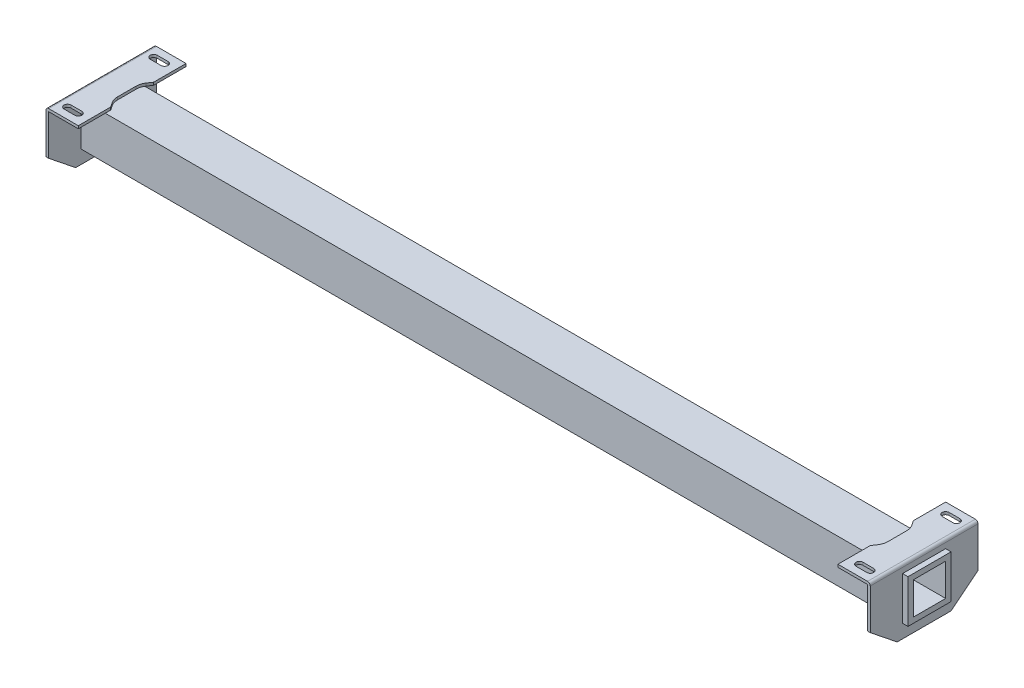
from build123d import *

# Parameters (mm, degrees)
SKETCH3_W                       = 80
SKETCH3_H                       = 80
SKETCH3_W_2                     = 60
SKETCH3_H_2                     = 60
BOSS_EXTRUDE2_DEPTH             = 1550
SKETCH7_W                       = 60
SKETCH7_H                       = 60
BOSS_EXTRUDE3_DEPTH             = 5
BOSS_EXTRUDE4_REACH             = 1561.207
SKETCH8_W                       = 60
SKETCH8_H                       = 5
BOSS_EXTRUDE4_DIRECTION_2_REACH = 1561.207
CUT_EXTRUDE1_REACH              = 1562.929
CUT_EXTRUDE2_REACH              = 1562.929
FILLET1_R                       = 5
MIRROR1_START                   = -90
MIRROR1_DEPTH                   = 10
MIRROR1_2_DEPTH                 = 10
MIRROR1_START_2                 = -80
MIRROR1_3_OUTLINE_W             = 5
MIRROR1_3_OUTLINE_H             = 25
MIRROR1_3_DEPTH                 = 80
MIRROR1_START_3                 = 10
MIRROR1_4_DEPTH                 = 31.124
MIRROR1_START_4                 = -119.452
MIRROR1_5_DEPTH                 = 29.452
MIRROR1_START_5                 = -140
MIRROR1_6_DEPTH                 = 200
MIRROR1_7_DEPTH                 = 5
FILLET1_OF_MIRROR2_R            = 5


with BuildPart() as part:
    # Sketch3 → Boss-Extrude2 (new body)
    with BuildSketch(Plane(origin=(0, 0, 0), x_dir=(0, 0, -1), z_dir=(1, 0, 0))):
        with Locations((40, 40)):
            Rectangle(SKETCH3_W, SKETCH3_H)
        with Locations((40, 40)):
            Rectangle(SKETCH3_W_2, SKETCH3_H_2, mode=Mode.SUBTRACT)
    extrude(amount=BOSS_EXTRUDE2_DEPTH)

    # Sketch7 → Boss-Extrude3 (add)
    with BuildSketch(Plane(origin=(1535, 0, 0), x_dir=(0, 0, -1), z_dir=(1, 0, 0))):
        Polygon((-60, 95), (140, 95), (140, 15), (90, -25), (-10, -25), (-60, 15), align=None)
        with Locations((40, 40)):
            Rectangle(SKETCH7_W, SKETCH7_H, mode=Mode.SUBTRACT)
    boss_extrude3 = extrude(amount=BOSS_EXTRUDE3_DEPTH)

    # Boss-Extrude4: up to this face of the body (flat: up to its plane)
    boss_extrude4_end = Plane(part.part.faces().sort_by_distance((1537.5, 55, -140))[0])
    # Sketch8 → Boss-Extrude4 (add, up to the picked face)
    with BuildSketch(Plane(origin=(0, 0, -80), x_dir=(-1, 0, 0), z_dir=(0, 0, -1)), mode=Mode.PRIVATE) as boss_extrude4_sk1:
        with Locations((-1510, 92.5)):
            Rectangle(SKETCH8_W, SKETCH8_H)
    boss_extrude4_tool1 = split(extrude(boss_extrude4_sk1.sketch, amount=BOSS_EXTRUDE4_REACH, mode=Mode.PRIVATE), bisect_by=boss_extrude4_end, keep=Keep.BOTH, mode=Mode.PRIVATE)
    boss_extrude4 = boss_extrude4_tool1.solids().sort_by(Axis((1510, 92.5, -80), (0, 0, -1)))[0]
    add(boss_extrude4)

    # Boss-Extrude4 direction 2: up to this face of the body (flat: up to its plane)
    boss_extrude4_direction_2_end = Plane(part.part.faces().sort_by_distance((1537.5, 55, 60))[0])
    # Sketch8 → Boss-Extrude4 direction 2 (add, up to the picked face)
    with BuildSketch(Plane(origin=(0, 0, -80), x_dir=(-1, 0, 0), z_dir=(0, 0, -1)), mode=Mode.PRIVATE) as boss_extrude4_direction_2_sk1:
        with Locations((-1510, 92.5)):
            Rectangle(SKETCH8_W, SKETCH8_H)
    boss_extrude4_direction_2_tool1 = split(extrude(boss_extrude4_direction_2_sk1.sketch, amount=-BOSS_EXTRUDE4_DIRECTION_2_REACH, mode=Mode.PRIVATE), bisect_by=boss_extrude4_direction_2_end, keep=Keep.BOTH, mode=Mode.PRIVATE)
    boss_extrude4_direction_2 = boss_extrude4_direction_2_tool1.solids().sort_by(Axis((1510, 92.5, -80), (0, 0, 1)))[0]
    add(boss_extrude4_direction_2)

    # Sketch9 → Cut-Extrude1 (cut, up to next)
    with BuildSketch(Plane(origin=(0, 95, 0), x_dir=(1, 0, 0), z_dir=(0, 1, 0)), mode=Mode.PRIVATE) as cut_extrude1_sk1:
        with BuildLine():
            Line((1480, 80), (1485.801257358, 71.298113962))
            ThreePointArc((1485.801257358, 71.298113962), (1488.927300662, 64.675212774), (1490, 57.430609057))
            Line((1490, 57.430609057), (1490, 22.569390943))
            ThreePointArc((1490, 22.569390943), (1488.927300662, 15.324787226), (1485.801257358, 8.701886038))
            Line((1485.801257358, 8.701886038), (1480, 0))
            Line((1480, 0), (1480, 80))
        make_face()
    cut_extrude1_tool1 = extrude(cut_extrude1_sk1.sketch, amount=-CUT_EXTRUDE1_REACH, mode=Mode.PRIVATE) & part.part
    cut_extrude1 = cut_extrude1_tool1.solids().sort_by_distance((1484.537596, 95, -40))[0]
    add(cut_extrude1, mode=Mode.SUBTRACT)

    # Sketch10 → Cut-Extrude2 (cut, up to next)
    with BuildSketch(Plane(origin=(0, 95, 0), x_dir=(1, 0, 0), z_dir=(0, 1, 0)), mode=Mode.PRIVATE) as cut_extrude2_sk1:
        with BuildLine():
            Line((1500, 126.5), (1520, 126.5))
            ThreePointArc((1520, 126.5), (1526.5, 120), (1520, 113.5))
            Line((1520, 113.5), (1500, 113.5))
            ThreePointArc((1500, 113.5), (1493.5, 120), (1500, 126.5))
        make_face()
    cut_extrude2_tool1 = extrude(cut_extrude2_sk1.sketch, amount=-CUT_EXTRUDE2_REACH, mode=Mode.PRIVATE) & part.part
    # Sketch10 → Cut-Extrude2 (cut, up to next)
    with BuildSketch(Plane(origin=(0, 95, 0), x_dir=(1, 0, 0), z_dir=(0, 1, 0)), mode=Mode.PRIVATE) as cut_extrude2_sk2:
        with BuildLine():
            Line((1500, -33.5), (1520, -33.5))
            ThreePointArc((1520, -33.5), (1526.5, -40), (1520, -46.5))
            Line((1520, -46.5), (1500, -46.5))
            ThreePointArc((1500, -46.5), (1493.5, -40), (1500, -33.5))
        make_face()
    cut_extrude2_tool2 = extrude(cut_extrude2_sk2.sketch, amount=-CUT_EXTRUDE2_REACH, mode=Mode.PRIVATE) & part.part
    cut_extrude2_1 = cut_extrude2_tool1.solids().sort_by_distance((1510, 95, -120))[0]
    add(cut_extrude2_1, mode=Mode.SUBTRACT)
    cut_extrude2_2 = cut_extrude2_tool2.solids().sort_by_distance((1510, 95, 40))[0]
    add(cut_extrude2_2, mode=Mode.SUBTRACT)
    cut_extrude2 = cut_extrude2_1 + cut_extrude2_2  # Cut-Extrude2 as one shape, for the pattern or mirror that repeats it

    # Fillet1
    fillet1_edges = [part.edges().sort_by_distance(p)[0] for p in [
        (1540, 95, -40),
    ]]
    fillet(fillet1_edges, radius=FILLET1_R)

    # Mirror1: read off the stored shape, not the designer's step
    # Mirror1 outline → Mirror1 (add)
    with BuildSketch(Plane.XY.offset(MIRROR1_START)):
        with BuildLine():
            Line((10, 90), (10, -25))
            Line((10, -25), (15, -25))
            Line((15, -25), (15, 95))
            ThreePointArc((15, 95), (11.464466094, 93.535533906), (10, 90))
        make_face()
    extrude(amount=MIRROR1_DEPTH)

    # Mirror1 2 outline → Mirror1 2 (add)
    with BuildSketch(Plane.XY):
        with BuildLine():
            Line((10, 90), (10, -25))
            Line((10, -25), (15, -25))
            Line((15, -25), (15, 95))
            ThreePointArc((15, 95), (11.464466094, 93.535533906), (10, 90))
        make_face()
    extrude(amount=MIRROR1_2_DEPTH)

    # Mirror1 3 outline → Mirror1 3 (add)
    with BuildSketch(Plane.XY.offset(MIRROR1_START_2)):
        with Locations((12.5, -12.5)):
            Rectangle(MIRROR1_3_OUTLINE_W, MIRROR1_3_OUTLINE_H)
        with BuildLine():
            Line((10, 90), (10, 80))
            Line((10, 80), (15, 80))
            Line((15, 80), (15, 95))
            ThreePointArc((15, 95), (11.464466094, 93.535533906), (10, 90))
        make_face()
    extrude(amount=MIRROR1_3_DEPTH)

    # Mirror1 4 outline → Mirror1 4 (add)
    with BuildSketch(Plane.XY.offset(MIRROR1_START_3)):
        with BuildLine():
            Line((10, 0), (15, 0))
            Line((15, 0), (15, 95))
            ThreePointArc((15, 95), (11.464466094, 93.535533906), (10, 90))
            Line((10, 90), (10, 0))
        make_face()
    extrude(amount=MIRROR1_4_DEPTH)

    # Mirror1 5 outline → Mirror1 5 (add)
    with BuildSketch(Plane.XY.offset(MIRROR1_START_4)):
        with BuildLine():
            Line((10, 0), (15, 0))
            Line((15, 0), (15, 95))
            ThreePointArc((15, 95), (11.464466094, 93.535533906), (10, 90))
            Line((10, 90), (10, 0))
        make_face()
    extrude(amount=MIRROR1_5_DEPTH)

    # Mirror1 6 outline → Mirror1 6 (add)
    with BuildSketch(Plane.XY.offset(MIRROR1_START_5)):
        with BuildLine():
            Line((10, 90), (10, 80))
            Line((10, 80), (15, 80))
            Line((15, 80), (15, 95))
            ThreePointArc((15, 95), (11.464466094, 93.535533906), (10, 90))
        make_face()
    extrude(amount=MIRROR1_6_DEPTH)

    # Mirror1 7 outline → Mirror1 7 (add)
    with BuildSketch(Plane.YZ.offset(MIRROR1_START_3)):
        Polygon((80, 41.124), (80, 60), (15, 60), (-25, 10), (0, 10), (0, 41.124), align=None)
        Polygon((0, -90), (-25, -90), (15, -140), (80, -140), (80, -119.452), (0, -119.452), align=None)
    extrude(amount=MIRROR1_7_DEPTH)

    # Mirror2: Boss-Extrude3, Boss-Extrude4, Boss-Extrude4 direction 2, Cut-Extrude1, Cut-Extrude2 across plane
    add(boss_extrude3.mirror(Plane(origin=(775, 0, 0), x_dir=(0, 0, 1), z_dir=(1, 0, 0))))
    add(boss_extrude4.mirror(Plane(origin=(775, 0, 0), x_dir=(0, 0, 1), z_dir=(1, 0, 0))))
    add(boss_extrude4_direction_2.mirror(Plane(origin=(775, 0, 0), x_dir=(0, 0, 1), z_dir=(1, 0, 0))))
    add(cut_extrude1.mirror(Plane(origin=(775, 0, 0), x_dir=(0, 0, 1), z_dir=(1, 0, 0))), mode=Mode.SUBTRACT)
    add(cut_extrude2.mirror(Plane(origin=(775, 0, 0), x_dir=(0, 0, 1), z_dir=(1, 0, 0))), mode=Mode.SUBTRACT)

    # Fillet1 of Mirror2
    fillet1_of_mirror2_edges = [part.edges().sort_by_distance(p)[0] for p in [
        (10, 95, -40),
    ]]
    fillet(fillet1_of_mirror2_edges, radius=FILLET1_OF_MIRROR2_R)


solid = part.part
